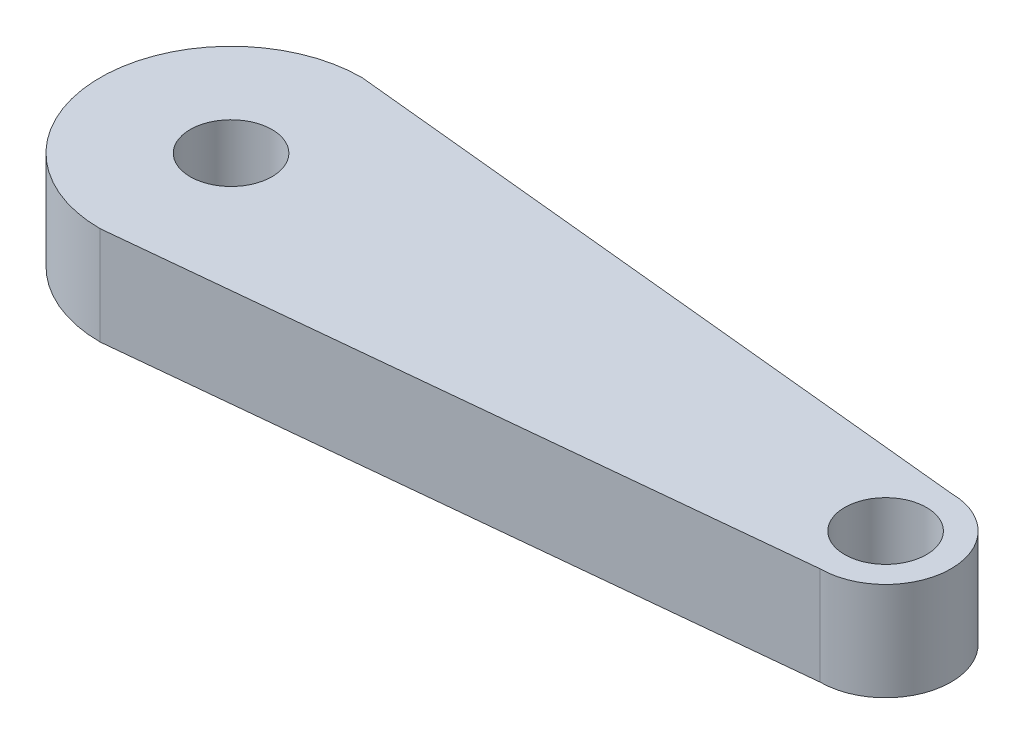
from build123d import *

# Parameters (mm, degrees)
BOSS_EXTRUDE1_DEPTH = 60
SKETCH3_R           = 25
CUT_EXTRUDE1_DEPTH  = 50


with BuildPart() as part:
    # Sketch2 → Boss-Extrude1 (new body)
    with BuildSketch(Plane(origin=(0, 0, 0), x_dir=(1, 0, 0), z_dir=(0, 1, 0))):
        with BuildLine():
            Line((0, 80), (400, 40))
            ThreePointArc((400, 40), (440, 0), (400, -40))
            Line((400, -40), (0, -80))
            ThreePointArc((0, -80), (-80, 0), (0, 80))
        make_face()
    extrude(amount=BOSS_EXTRUDE1_DEPTH)

    # Sketch3 → Cut-Extrude1 (cut)
    with BuildSketch(Plane(origin=(0, 60, 0), x_dir=(1, 0, 0), z_dir=(0, 1, 0))):
        Circle(SKETCH3_R)
        with Locations((400, 0)):
            Circle(SKETCH3_R)
    extrude(amount=-CUT_EXTRUDE1_DEPTH, mode=Mode.SUBTRACT)


solid = part.part
